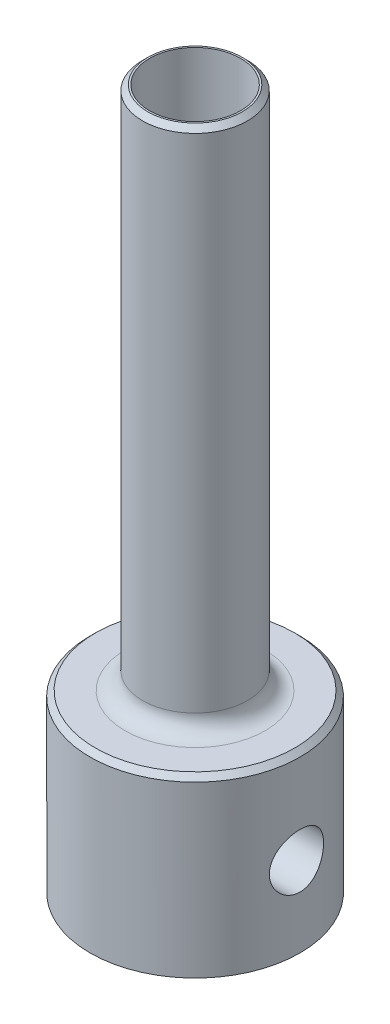
from build123d import *

# Parameters (mm, degrees)
SKETCH6_R               = 6
BOSS_EXTRUDE4_DEPTH     = 10
SKETCH7_R               = 3
BOSS_EXTRUDE5_DEPTH     = 30
CHAMFER1_SIZE           = 0.3
CHAMFER2_SIZE           = 0.3
CUT_EXTRUDE4_DEPTH      = 43.190046219
CUT_EXTRUDE4_DEPTH_BACK = 43.190046219
SKETCH10_R              = 1.55
CUT_EXTRUDE5_DEPTH      = 41.89009673
CUT_EXTRUDE5_DEPTH_BACK = 41.89009673
SKETCH11_R              = 2.6
FILLET1_R               = 1


with BuildPart() as part:
    # Sketch6 → Boss-Extrude4 (new body)
    with BuildSketch(Plane(origin=(0, 0, 0), x_dir=(1, 0, 0), z_dir=(0, 1, 0))):
        Circle(SKETCH6_R)
    extrude(amount=BOSS_EXTRUDE4_DEPTH)

    # Sketch7 → Boss-Extrude5 (add)
    with BuildSketch(Plane(origin=(0, 10, 0), x_dir=(1, 0, 0), z_dir=(0, 1, 0))):
        Circle(SKETCH7_R)
    extrude(amount=BOSS_EXTRUDE5_DEPTH)

    # Chamfer1
    chamfer1_edges = [part.edges().sort_by_distance(p)[0] for p in [
        (-3, 40, 0),
    ]]
    chamfer(chamfer1_edges, length=CHAMFER1_SIZE)

    # Chamfer2
    chamfer2_edges = [part.edges().sort_by_distance(p)[0] for p in [
        (-6, 10, 0),
    ]]
    chamfer(chamfer2_edges, length=CHAMFER2_SIZE)

    # Sketch10 → Cut-Extrude4 (cut, two sides: drawn at the far end of the back side and taken through both)
    with BuildSketch(Plane.ZY.offset(6).offset(-CUT_EXTRUDE4_DEPTH_BACK)):
        with Locations((0, 4.567060469)):
            Circle(SKETCH10_R)
    extrude(amount=CUT_EXTRUDE4_DEPTH + CUT_EXTRUDE4_DEPTH_BACK, mode=Mode.SUBTRACT)

    # Sketch11 → Cut-Extrude5 (cut, two sides: drawn at the far end of the back side and taken through both)
    with BuildSketch(Plane(origin=(0, 40, 0), x_dir=(1, 0, 0), z_dir=(0, 1, 0)).offset(-CUT_EXTRUDE5_DEPTH_BACK)):
        Circle(SKETCH11_R)
    extrude(amount=CUT_EXTRUDE5_DEPTH + CUT_EXTRUDE5_DEPTH_BACK, mode=Mode.SUBTRACT)

    # Fillet1
    fillet1_edges = [part.edges().sort_by_distance(p)[0] for p in [
        (-3, 10, 0),
    ]]
    fillet(fillet1_edges, radius=FILLET1_R)


solid = part.part
